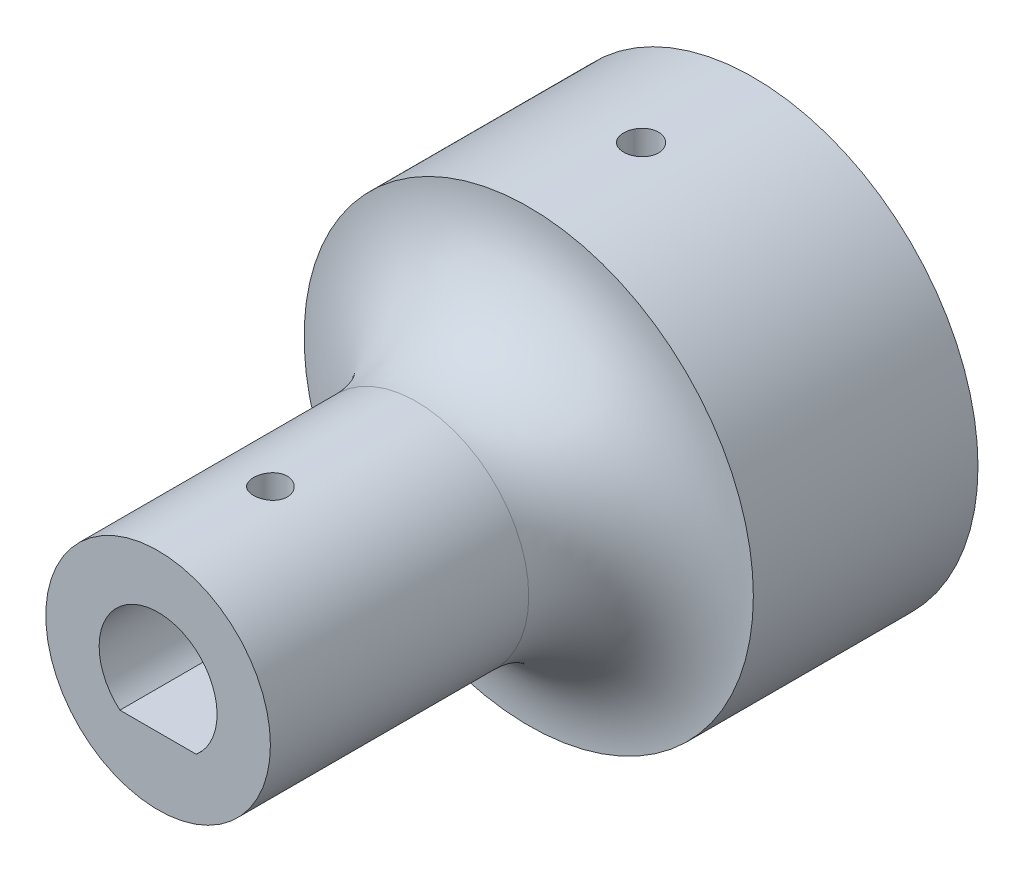
from build123d import *

# Parameters (mm, degrees)
SKETCH_1_R               = 20
EXTRUDE_1_DEPTH          = 20
SKETCH_2_R               = 10
EXTRUDE_2_DEPTH          = 33
SKETCH_4_W               = 21
SKETCH_4_H               = 21
SKETCH_4_W_2             = 17
SKETCH_4_H_2             = 17
CUT_EXTRUDE_3_DEPTH      = 15
CUT_EXTRUDE_4_DEPTH      = 61.074953184
CUT_EXTRUDE_4_DEPTH_BACK = 61.074953184
SKETCH_5_R               = 1.55
FILLET_1_R               = 10
CUT_EXTRUDE_6_DEPTH      = 20
CUT_EXTRUDE_7_DEPTH      = 62.522353742
CUT_EXTRUDE_7_DEPTH_BACK = 62.522353742
SKETCH_9_R               = 1.5


with BuildPart() as part:
    # 草图1 → 凸台-拉伸1 (new body)
    with BuildSketch(Plane.XY):
        Circle(SKETCH_1_R)
    extrude(amount=EXTRUDE_1_DEPTH)

    # 草图2 → 凸台-拉伸2 (add)
    with BuildSketch(Plane.XY.offset(20)):
        Circle(SKETCH_2_R)
    extrude(amount=EXTRUDE_2_DEPTH)

    # 草图4 → 切除-拉伸3 (cut)
    with BuildSketch(Plane(origin=(0, 0, 0), x_dir=(-1, 0, 0), z_dir=(0, 0, -1))):
        Rectangle(SKETCH_4_W, SKETCH_4_H)
        Rectangle(SKETCH_4_W_2, SKETCH_4_H_2, mode=Mode.SUBTRACT)
    extrude(amount=-CUT_EXTRUDE_3_DEPTH, mode=Mode.SUBTRACT)

    # 草图5 → 切除-拉伸4 (cut, two sides: drawn at the far end of the back side and taken through both)
    with BuildSketch(Plane(origin=(0, 0, 0), x_dir=(1, 0, 0), z_dir=(0, 1, 0)).offset(-CUT_EXTRUDE_4_DEPTH_BACK)):
        with Locations(Location((0, -10, 0), (0, 0, 270))):
            Circle(SKETCH_5_R)
    extrude(amount=CUT_EXTRUDE_4_DEPTH + CUT_EXTRUDE_4_DEPTH_BACK, mode=Mode.SUBTRACT)

    # 圆角1
    fillet_1_edges = [part.edges().sort_by_distance(p)[0] for p in [
        (-10, 0, 20),
    ]]
    fillet(fillet_1_edges, radius=FILLET_1_R - 0.0001)  # a hair under: the kernel refuses the full size

    # 草图8 → 切除-拉伸6 (cut)
    with BuildSketch(Plane.XY.offset(53)):
        with BuildLine():
            Line((-3.400367627, -4), (3.400367627, -4))
            ThreePointArc((3.400367627, -4), (0, 5.25), (-3.400367627, -4))
        make_face()
    extrude(amount=-CUT_EXTRUDE_6_DEPTH, mode=Mode.SUBTRACT)

    # 草图9 → 切除-拉伸7 (cut, two sides: drawn at the far end of the back side and taken through both)
    with BuildSketch(Plane(origin=(0, -4, 0), x_dir=(1, 0, 0), z_dir=(0, 1, 0)).offset(-CUT_EXTRUDE_7_DEPTH_BACK)):
        with Locations(Location((0, -43, 0), (0, 0, 180))):
            Circle(SKETCH_9_R)
    extrude(amount=CUT_EXTRUDE_7_DEPTH + CUT_EXTRUDE_7_DEPTH_BACK, mode=Mode.SUBTRACT)


solid = part.part
